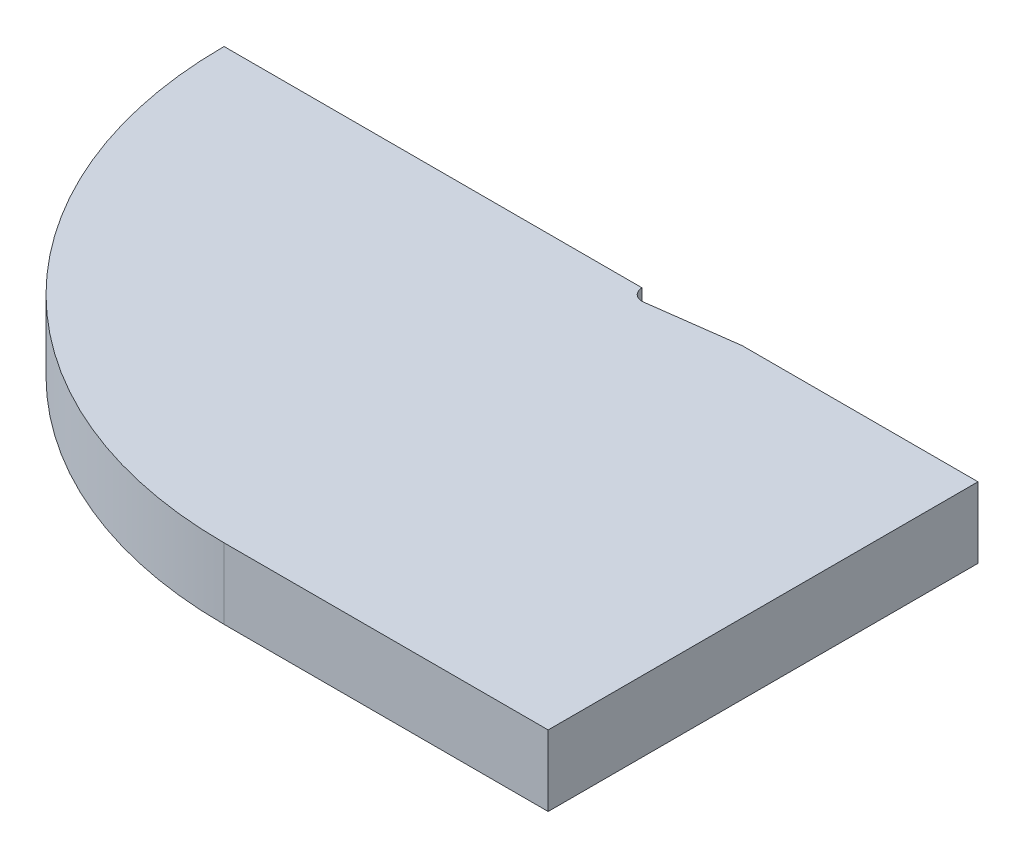
from build123d import *

# Parameters (mm, degrees)
THICKEN1_DEPTH     = 215
SKETCH5_W          = 2293.9698
SKETCH5_H          = 1307.808
CUT_EXTRUDE1_DEPTH = 1837.971398424


# Read off the part's stored shape, not the designer's step: Thicken1
with BuildPart() as part:
    # Thicken1 outline → Thicken1 (new body)
    with BuildSketch(Plane(origin=(0, 0, 0), x_dir=(1, 0, 0), z_dir=(0, 1, 0))):
        with BuildLine():
            Line((35.85, -1307.808), (1022.0118, -1307.808))
            Line((1022.0118, -1307.808), (1022.0118, 1307.808))
            Line((1022.0118, 1307.808), (35.85, 1307.808))
            ThreePointArc((35.85, 1307.808), (-1271.958, 0), (35.85, -1307.808))
        make_face()
        with BuildLine():
            Line((305, 0), (35.85, -35.85))
            ThreePointArc((35.85, -35.85), (0, 0), (35.85, 35.85))
            Line((35.85, 35.85), (305, 0))
        make_face(mode=Mode.SUBTRACT)
    extrude(amount=THICKEN1_DEPTH)

    # Sketch5 → Cut-Extrude1 (cut, through all)
    with BuildSketch(Plane(origin=(0, 215, 0), x_dir=(1, 0, 0), z_dir=(0, 1, 0))):
        with Locations((-124.9731, 653.904)):
            Rectangle(SKETCH5_W, SKETCH5_H)
    extrude(amount=-CUT_EXTRUDE1_DEPTH, mode=Mode.SUBTRACT)


solid = part.part
